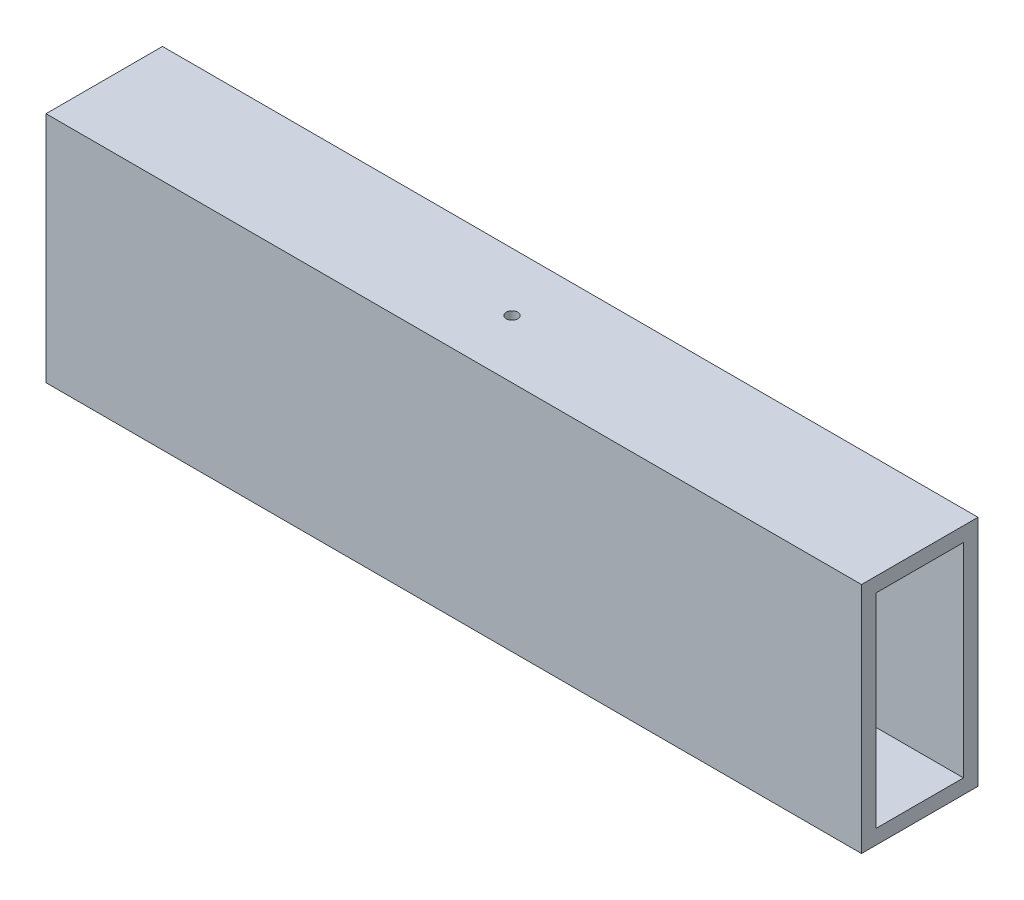
from build123d import *

# Parameters (mm, degrees)
SKETCH1_W             = 25.4
SKETCH1_H             = 50.8
SKETCH1_W_2           = 19.05
SKETCH1_H_2           = 44.45
BOSS_EXTRUDE1_DEPTH   = 177.8
M3X0_5_TAPPED_HOLE3_D = 2.5


with BuildPart() as part:
    # Sketch1 → Boss-Extrude1 (new body)
    with BuildSketch(Plane(origin=(0, 0, 0), x_dir=(0, 0, -1), z_dir=(1, 0, 0))):
        Rectangle(SKETCH1_W, SKETCH1_H)
        Rectangle(SKETCH1_W_2, SKETCH1_H_2, mode=Mode.SUBTRACT)
    extrude(amount=BOSS_EXTRUDE1_DEPTH)

    # M3x0.5 Tapped Hole3 (through all)
    with Locations(Plane(origin=(88.9, -25.4, 0), x_dir=(0, 0, -1), z_dir=(0, -1, 0))):
        with Locations((0, 0)):
            Hole(M3X0_5_TAPPED_HOLE3_D / 2)


solid = part.part
